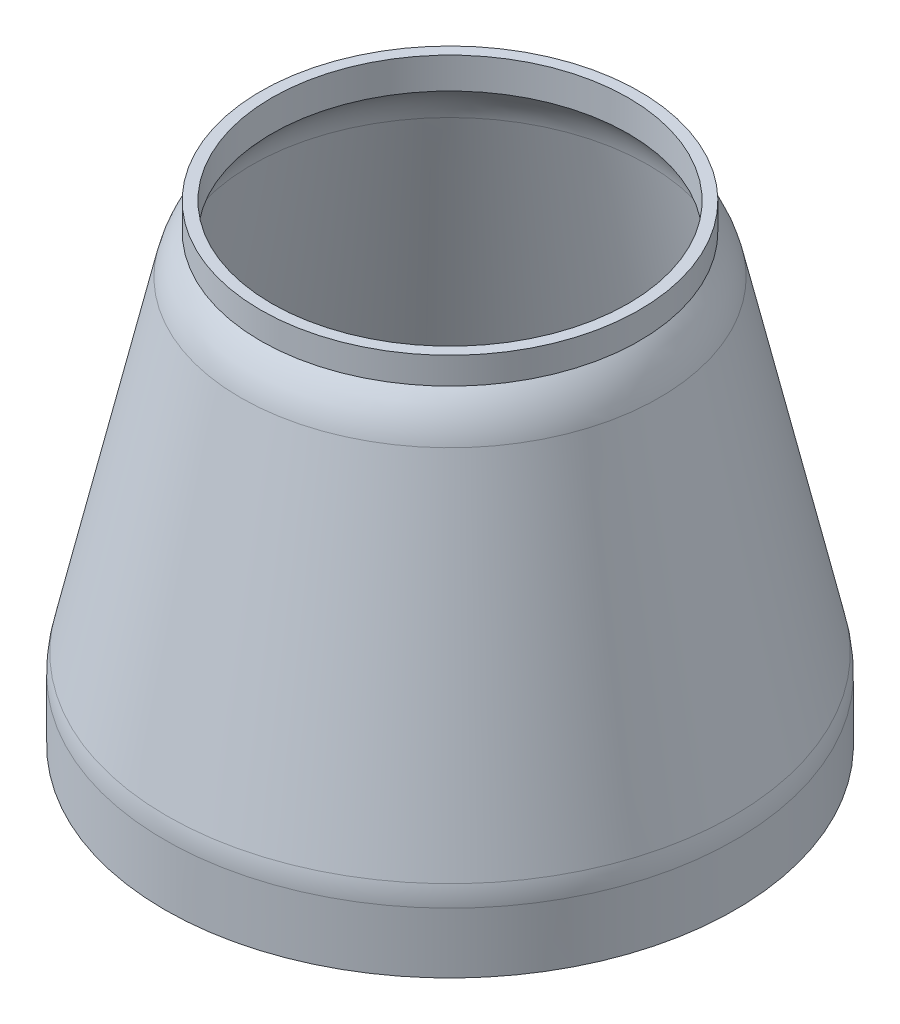
from build123d import *

# Parameters (mm, degrees)
SKETCH1_R           = 64
BOSS_EXTRUDE1_DEPTH = 15.8
SKETCH2_R           = 45
SKETCH3_R           = 42.5
BOSS_EXTRUDE2_DEPTH = 6
SKETCH4_R           = 50
CUT_EXTRUDE1_DEPTH  = 6
CUT_EXTRUDE1_DRAFT  = -20


with BuildPart() as part:
    # Sketch1 → Boss-Extrude1 (new body)
    with BuildSketch(Plane(origin=(0, 0, 0), x_dir=(1, 0, 0), z_dir=(0, 1, 0))):
        with Locations(Location((0, 0, 0), (0, 0, 270))):
            Circle(SKETCH1_R)
    extrude(amount=BOSS_EXTRUDE1_DEPTH)

    # Sketch2 → section 1 of loft1
    with BuildSketch(Plane(origin=(0, 99.8, 0), x_dir=(1, 0, 0), z_dir=(0, 1, 0)), mode=Mode.PRIVATE) as loft1_s1:
        Circle(SKETCH2_R)
    # loft up to a face of the part (loft1)
    loft([Face(Wire([part.edges().sort_by_distance((46.653992155, 15.8, -43.811014779))[0]])), loft1_s1.sketch])

    # Sketch3 → Boss-Extrude2 (add)
    with BuildSketch(Plane(origin=(0, 99.8, 0), x_dir=(1, 0, 0), z_dir=(0, 1, 0))):
        with Locations(Location((0, 0, 0), (0, 0, 270))):
            Circle(SKETCH3_R)
    extrude(amount=BOSS_EXTRUDE2_DEPTH)

    # Fillet1: read off the stored shape, not the designer's step
    # Fillet1 outline → Fillet1 (revolve, cut)
    with BuildSketch(Plane.XY):
        with BuildLine():
            Line((46.989688752, 91.003481309), (46.989688752, 99.8))
            Line((46.989688752, 99.8), (42.5, 99.8))
            ThreePointArc((42.5, 99.8), (45.296348434, 95.683224916), (46.989688752, 91.003481309))
        make_face()
        with BuildLine():
            Line((64, 17.978653915), (63.507209234, 17.978653915))
            ThreePointArc((63.507209234, 17.978653915), (63.876420511, 15.78619808), (64, 13.566308969))
            Line((64, 13.566308969), (64, 17.978653915))
        make_face()
    revolve(axis=Axis((0, 0, 0), (0, 1, 0)), mode=Mode.SUBTRACT)


with BuildPart() as cut_extrude1_tool:
    # Sketch4 → Cut-Extrude1 (with draft: the straight prism first)
    with BuildSketch(Plane.XZ):
        Circle(SKETCH4_R)
    extrude(amount=-CUT_EXTRUDE1_DEPTH)
    # Cut-Extrude1: the draft: its side faces are tilted about the plane it starts from
    cut_extrude1_sides = [cut_extrude1_tool.faces().sort_by_distance(p)[0] for p in [
        (-50, 3, 0),
    ]]
    draft(cut_extrude1_sides, Plane.XZ, CUT_EXTRUDE1_DRAFT)


with BuildPart() as part_1:
    add(part.part)

    # Cut-Extrude1: cut by cut_extrude1_tool
    add(cut_extrude1_tool.part, mode=Mode.SUBTRACT)

    # Shell1: read off the stored shape, not the designer's step
    # Shell1 outline → Shell1 (revolve, cut)
    with BuildSketch(Plane.XY):
        with BuildLine():
            ThreePointArc((61.5, 13.566308969), (61.391867947, 15.508711941), (61.068808079, 17.427110797))
            Line((61.068808079, 17.427110797), (44.551287597, 90.451938191))
            ThreePointArc((44.551287597, 90.451938191), (42.856049683, 94.951958116), (40, 98.820677687))
            Line((40, 98.820677687), (40, 105.8))
            Line((40, 105.8), (0, 105.8))
            Line((0, 105.8), (0, 8.5))
            Line((0, 8.5), (49.56669744, 8.5))
            Line((49.56669744, 8.5), (51.750518846, 2.5))
            Line((51.750518846, 2.5), (61.5, 2.5))
            Line((61.5, 2.5), (61.5, 13.566308969))
        make_face()
    revolve(axis=Axis((0, 0, 0), (0, 1, 0)), mode=Mode.SUBTRACT)


solid = part_1.part
